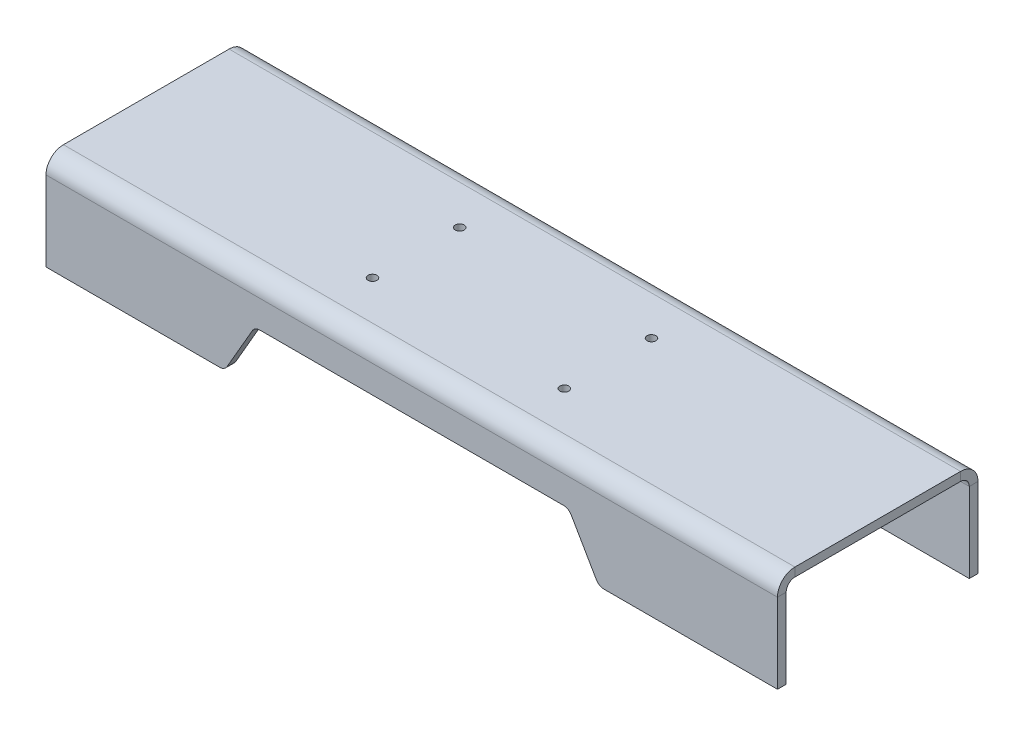
from build123d import *

# Parameters (mm, degrees)
SM_BASE_FLANGE_1_DEPTH  = 419.5
CUT_EXTRUDE_1_DEPTH     = 492.235686814
FILLET_1_R              = 10
HOLE_WIZARD_M12_1_D     = 10.2
HOLE_WIZARD_M12_1_DEPTH = 32.75
HOLE_WIZARD_M12_1_TIP   = 3.064389157


# Sheet-metal steps are written as plain solids
with BuildPart() as part:
    # Sketch 1 → 基体-法兰1 (new, symmetric)
    with BuildSketch(Plane(origin=(0, 0, 0), x_dir=(0, 0, -1), z_dir=(1, 0, 0))):
        with BuildLine():
            Line((-115, -111.5), (-115, -20))
            ThreePointArc((-115, -20), (-109.142135624, -5.857864376), (-95, 0))
            Line((-95, 0), (95, 0))
            ThreePointArc((95, 0), (109.142135624, -5.857864376), (115, -20))
            Line((115, -20), (115, -111.5))
            Line((115, -111.5), (105, -111.5))
            Line((105, -111.5), (105, -20))
            ThreePointArc((105, -20), (102.071067812, -12.928932188), (95, -10))
            Line((95, -10), (-95, -10))
            ThreePointArc((-95, -10), (-102.071067812, -12.928932188), (-105, -20))
            Line((-105, -20), (-105, -111.5))
            Line((-105, -111.5), (-115, -111.5))
        make_face()
    extrude(amount=SM_BASE_FLANGE_1_DEPTH, both=True)

    # Sketch 2 → 切除-拉伸1 (cut, through all)
    with BuildSketch(Plane(origin=(0, 0, -115), x_dir=(-1, 0, 0), z_dir=(0, 0, -1))):
        Polygon((-214.641016151, -111.5), (-180, -51.5), (180, -51.5), (214.641016151, -111.5), align=None)
    extrude(amount=-CUT_EXTRUDE_1_DEPTH, mode=Mode.SUBTRACT)

    # 圆角1
    fillet_1_edges = [part.edges().sort_by_distance(p)[0] for p in [
        (-214.641016151, -111.5, -110),
        (214.641016151, -111.5, -110),
        (180, -51.5, -110),
        (-180, -51.5, -110),
        (214.641016151, -111.5, 110),
        (-214.641016151, -111.5, 110),
        (-180, -51.5, 110),
        (180, -51.5, 110),
    ]]
    fillet(fillet_1_edges, radius=FILLET_1_R)

    # M12 螺纹孔1
    with Locations(Plane(origin=(0, 0, 0), x_dir=(1, 0, 0), z_dir=(0, 1, 0))):
        with Locations((-110, 50), (110, 50), (110, -50), (-110, -50)):
            Hole(HOLE_WIZARD_M12_1_D / 2, depth=HOLE_WIZARD_M12_1_DEPTH)
            with Locations((0, 0, -(HOLE_WIZARD_M12_1_DEPTH + HOLE_WIZARD_M12_1_TIP / 2))):  # 118° drill point
                Cone(0, HOLE_WIZARD_M12_1_D / 2, HOLE_WIZARD_M12_1_TIP, mode=Mode.SUBTRACT)


solid = part.part
